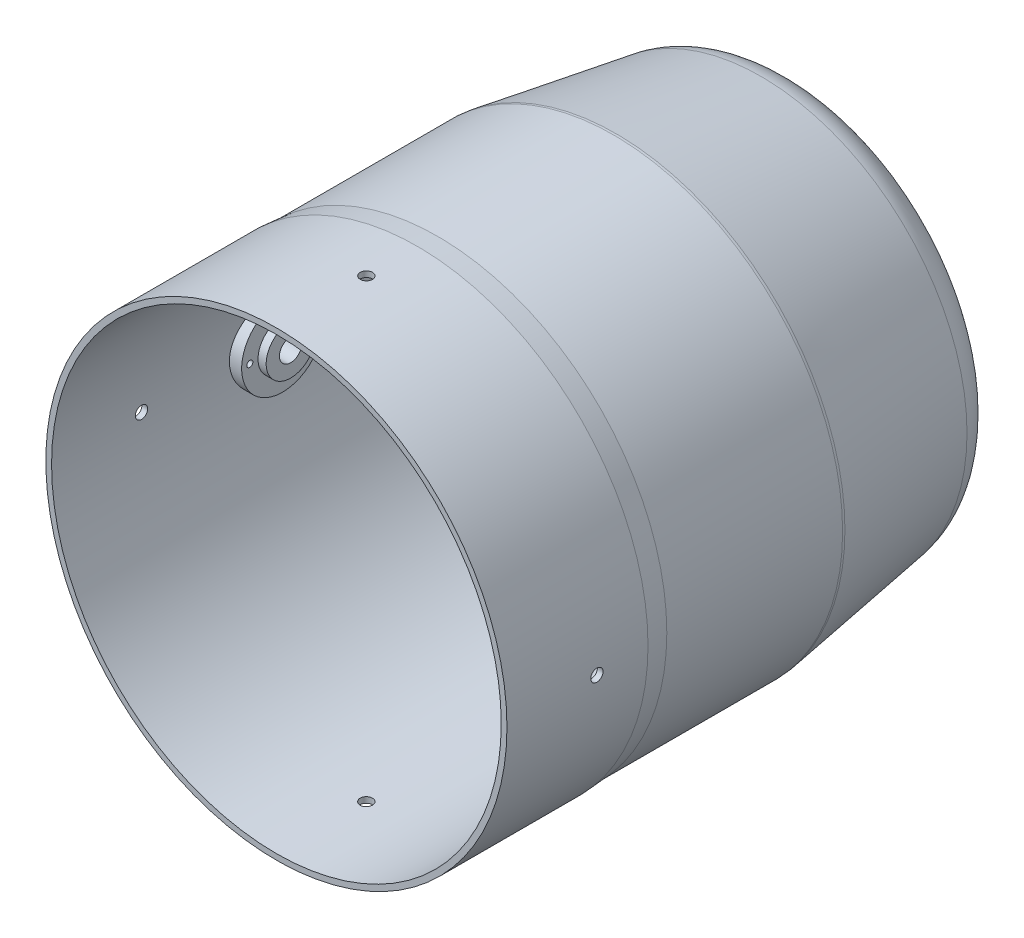
from build123d import *

# Parameters (mm, degrees)
ESQUISSE2_R                  = 1.5
ENL_V_MAT_EXTRU_1_DEPTH      = 150.969730279
R_P_TITION_CIRCULAIRE2_COUNT = 10
ESQUISSE3_R                  = 1.5
ENL_V_MAT_EXTRU_2_DEPTH      = 150.969730279
R_P_TITION_CIRCULAIRE1_COUNT = 4
ESQUISSE4_R                  = 5.45
ENL_V_MAT_EXTRU_3_DEPTH      = 150.969730358
ESQUISSE6_R                  = 67.523867593
ESQUISSE6_R_2                = 55
EXTRUSION1_DEPTH             = 154.235610449
ESQUISSE7_R                  = 0.75
EXTRUSION2_DEPTH             = 10
R_P_TITION_CIRCULAIRE3_COUNT = 3
R_P_TITION_CIRCULAIRE4_COUNT = 3


with BuildPart() as part:
    # Esquisse1 → Base-Révolution (revolve)
    with BuildSketch(Plane(origin=(0, 0, 0), x_dir=(0, 0, -1), z_dir=(1, 0, 0)), mode=Mode.PRIVATE) as base_r_volution_sk:
        with BuildLine():
            Line((0, 56.4), (34.5, 56.4))
            Line((34.5, 56.4), (39.5, 56))
            Line((39.5, 56), (82.5, 56))
            ThreePointArc((82.5, 56), (82.811692311, 55.987837497), (83.121489143, 55.951423952))
            Line((83.121489143, 55.951423952), (118.553722858, 50.378559879))
            ThreePointArc((118.553722858, 50.378559879), (124.600566709, 46.998567974), (127, 40.5))
            Line((127, 40.5), (127, 34.5))
            Line((127, 34.5), (126, 34.5))
            Line((126, 34.5), (126, 40.5))
            ThreePointArc((126, 40.5), (123.840510038, 46.348711176), (118.398350572, 49.390703891))
            Line((118.398350572, 49.390703891), (82.966116857, 54.963567964))
            ThreePointArc((82.966116857, 54.963567964), (82.733769233, 54.990878123), (82.5, 55))
            Line((82.5, 55), (0, 55))
            Line((0, 55), (0, 56.4))
        make_face()
    revolve(base_r_volution_sk.sketch.rotate(Axis((0, 0, 74.926735219), (0, 0, -1)), 90), axis=Axis((0, 0, 74.926735219), (0, 0, -1)))

    # Esquisse2 → Enlèv. mat.-Extru.1 (cut, through all)
    with BuildSketch(Plane.XY.offset(-127)):
        with Locations(Location((0, 37, 0), (0, 0, 180))):
            Circle(ESQUISSE2_R)
    enl_v_mat_extru_1 = extrude(amount=ENL_V_MAT_EXTRU_1_DEPTH, mode=Mode.SUBTRACT)

    # Répétition circulaire2: Enlèv. mat.-Extru.1 ×10 about axis
    r_p_tition_circulaire2_axis = Axis((0, 0, 0), (0, 0, 1))
    for i in range(1, R_P_TITION_CIRCULAIRE2_COUNT):
        add(enl_v_mat_extru_1.rotate(r_p_tition_circulaire2_axis, i * 360 / R_P_TITION_CIRCULAIRE2_COUNT), mode=Mode.SUBTRACT)

    # Esquisse3 → Enlèv. mat.-Extru.2 (cut, through all)
    with BuildSketch(Plane(origin=(0, 0, 0), x_dir=(1, 0, 0), z_dir=(0, 1, 0))):
        with Locations(Location((0, 22, 0), (0, 0, 90))):
            Circle(ESQUISSE3_R)
    enl_v_mat_extru_2 = extrude(amount=ENL_V_MAT_EXTRU_2_DEPTH, mode=Mode.SUBTRACT)

    # Répétition circulaire1: Enlèv. mat.-Extru.2 ×4 about axis
    r_p_tition_circulaire1_axis = Axis((0, 0, 74.926735219), (0, 0, -1))
    for i in range(1, R_P_TITION_CIRCULAIRE1_COUNT):
        add(enl_v_mat_extru_2.rotate(r_p_tition_circulaire1_axis, i * 360 / R_P_TITION_CIRCULAIRE1_COUNT), mode=Mode.SUBTRACT)

    # Esquisse4 → Enlèv. mat.-Extru.3 (cut, through all)
    with BuildSketch(Plane.YZ):
        with Locations(Location((0, -53.5, 0), (0, 0, 270))):
            Circle(ESQUISSE4_R)
    extrude(amount=-ENL_V_MAT_EXTRU_3_DEPTH, mode=Mode.SUBTRACT)


with BuildPart() as body_2:
    # Esquisse5 → Révolution1 (revolve)
    with BuildSketch(Plane(origin=(0, 0, 0), x_dir=(1, 0, 0), z_dir=(0, 1, 0))):
        Polygon((-64.58476831, 63.5), (-52, 63.5), (-52, 59.5), (-50, 59.5), (-50, 56.25), (-64.58476831, 56.25), align=None)
    revolve(axis=Axis((0, 0, -53.5), (-1, 0, 0)))

    # Esquisse6 → Extrusion1 (cut, through all)
    with BuildSketch(Plane.XY):
        Circle(ESQUISSE6_R)
        Circle(ESQUISSE6_R_2, mode=Mode.SUBTRACT)
    extrude(amount=-EXTRUSION1_DEPTH, mode=Mode.SUBTRACT)


with BuildPart() as extrusion2_tool:
    # Esquisse7 → Extrusion2 (new body)
    with BuildSketch(Plane(origin=(-52, 0, 0), x_dir=(0, 0, -1), z_dir=(1, 0, 0))):
        with Locations((45.5, 0)):
            Circle(ESQUISSE7_R)
    extrusion2 = extrude(amount=-EXTRUSION2_DEPTH)


with BuildPart() as part_1:
    add(part.part)

    # Extrusion2: cut by extrusion2_tool
    add(extrusion2_tool.part, mode=Mode.SUBTRACT)


with BuildPart() as body_2_1:
    add(body_2.part)

    # Extrusion2: cut by extrusion2_tool
    add(extrusion2_tool.part, mode=Mode.SUBTRACT)


with BuildPart() as r_p_tition_circulaire3_tool:
    # Répétition circulaire3: Extrusion2 ×3 about axis
    r_p_tition_circulaire3_axis = Axis((0, 0, -53.5), (1, 0, 0))
    for i in range(1, R_P_TITION_CIRCULAIRE3_COUNT):
        add(extrusion2.rotate(r_p_tition_circulaire3_axis, i * 360 / R_P_TITION_CIRCULAIRE3_COUNT))


with BuildPart() as part_2:
    add(part_1.part)

    # Répétition circulaire3: cut by r_p_tition_circulaire3_tool
    add(r_p_tition_circulaire3_tool.part, mode=Mode.SUBTRACT)


with BuildPart() as body_2_2:
    add(body_2_1.part)

    # Répétition circulaire3: cut by r_p_tition_circulaire3_tool
    add(r_p_tition_circulaire3_tool.part, mode=Mode.SUBTRACT)


with BuildPart() as body_3:
    # Esquisse8 → Révolution2 (revolve)
    with BuildSketch(Plane(origin=(0, 0, 0), x_dir=(1, 0, 0), z_dir=(0, 1, 0))):
        Polygon((-56, 43.25), (-53.75, 45.5), (-56, 45.5), (-60.565021968, 45.5), (-60.565021968, 43.25), align=None)
    revolve(axis=Axis((-74.831400747, 0, -45.5), (1, 0, 0)))


with BuildPart() as r_p_tition_circulaire4_1:
    # Répétition circulaire4: pattern copy
    add(body_3.part.rotate(Axis((0, 0, -53.5), (1, 0, 0)), 1 * 360 / R_P_TITION_CIRCULAIRE4_COUNT))


with BuildPart() as r_p_tition_circulaire4_2:
    # Répétition circulaire4: pattern copy
    add(body_3.part.rotate(Axis((0, 0, -53.5), (1, 0, 0)), 2 * 360 / R_P_TITION_CIRCULAIRE4_COUNT))


with BuildPart() as body_6:
    # Corps-Déplacer/Copier1: read off the stored shape, not the designer's step
    # Corps-Déplacer/Copier1 outline → Corps-Déplacer/Copier1 (revolve)
    with BuildSketch(Plane(origin=(0, -6.92820323, -57.5), x_dir=(0, 1, 0), z_dir=(0, 0, -1))):
        Polygon((2.25, -60.565021968), (2.25, -56), (0, -53.75), (0, -60.565021968), align=None)
    revolve(axis=Axis((0, -6.92820323, -57.5), (1, 0, 0)))


with BuildPart() as body_7:
    # Corps-D_placer_Copier1 2 outline → Corps-D_placer_Copier1 2 (revolve)
    with BuildSketch(Plane(origin=(0, 6.92820323, -57.5), x_dir=(0, 1, 0), z_dir=(0, 0, -1))):
        Polygon((2.25, -60.565021968), (2.25, -56), (0, -53.75), (0, -60.565021968), align=None)
    revolve(axis=Axis((0, 6.92820323, -57.5), (1, 0, 0)))


with BuildPart() as body_8:
    # Corps-D_placer_Copier1 3 outline → Corps-D_placer_Copier1 3 (revolve)
    with BuildSketch(Plane.YX.offset(45.5)):
        Polygon((2.25, -60.565021968), (2.25, -56), (0, -53.75), (0, -60.565021968), align=None)
    revolve(axis=Axis((0, 0, -45.5), (1, 0, 0)))


with BuildPart() as part_3:
    add(part_2.part)

    # Combiner1: read off the stored shape, not the designer's step
    # Combiner1: cut Répétition circulaire4_1, Répétition circulaire4_2, body 3
    add(r_p_tition_circulaire4_1.part, mode=Mode.SUBTRACT)
    add(r_p_tition_circulaire4_2.part, mode=Mode.SUBTRACT)
    add(body_3.part, mode=Mode.SUBTRACT)


with BuildPart() as body_2_3:
    add(body_2_2.part)

    # Combiner2: cut body 8, body 6, body 7
    add(body_8.part, mode=Mode.SUBTRACT)
    add(body_6.part, mode=Mode.SUBTRACT)
    add(body_7.part, mode=Mode.SUBTRACT)


solid = Compound([part_3.part, body_2_3.part])
